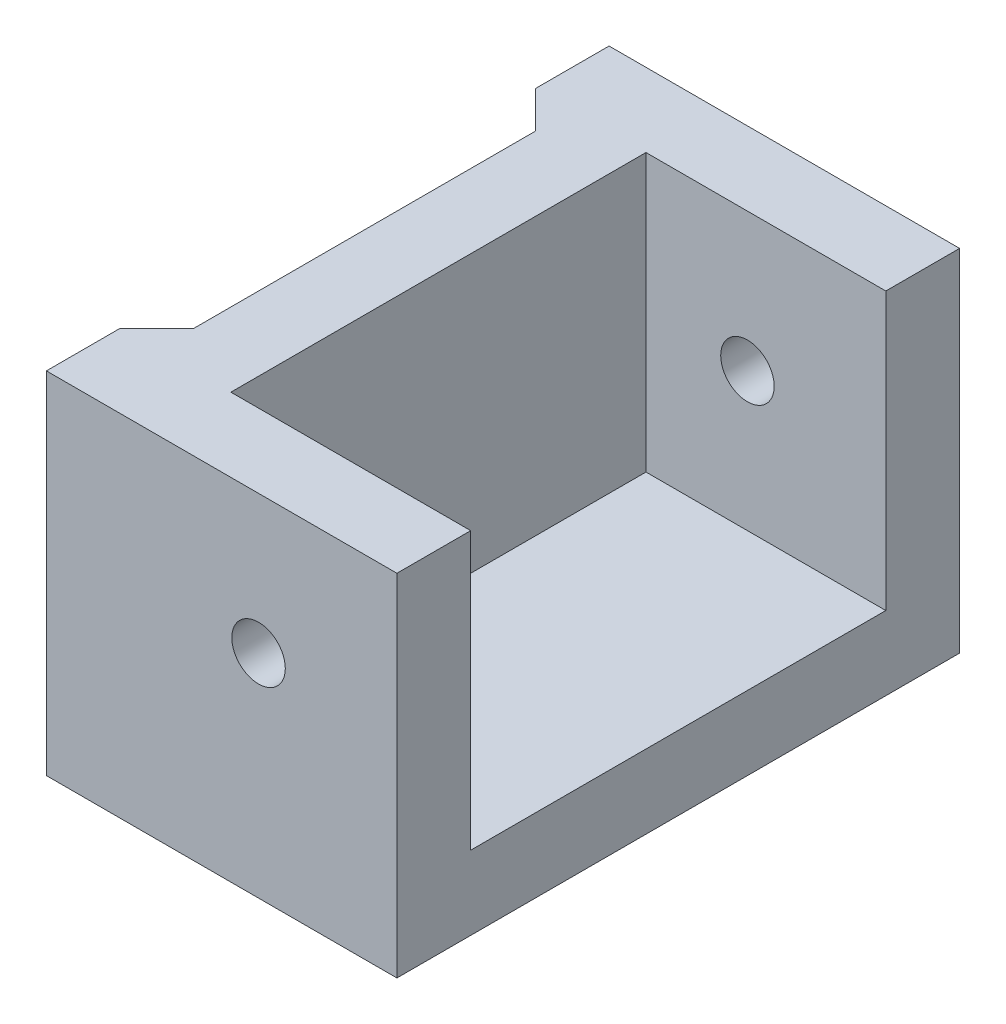
from build123d import *

# Parameters (mm, degrees)
BOSS_EXTRUDE1_DEPTH = 38.735
SKETCH2_W           = 24.13
SKETCH2_H           = 24.13
SKETCH2_R           = 1.8415
BOSS_EXTRUDE2_DEPTH = 5.08
BOSS_EXTRUDE3_START = -5.08
SKETCH3_W           = 24.13
SKETCH3_H           = 24.13
SKETCH3_R           = 1.8415
BOSS_EXTRUDE3_DEPTH = 5.08
SKETCH4_W           = 38.735
SKETCH4_H           = 5.875923506
BOSS_EXTRUDE5_DEPTH = 21.59
SKETCH5_W           = 28.575
SKETCH5_H           = 2.54
CUT_EXTRUDE1_DEPTH  = 16.51
CHAMFER2_SIZE       = 2.54


with BuildPart() as part:
    # Sketch1 → Boss-Extrude1 (new body)
    with BuildSketch(Plane.XY):
        Polygon((0, 0), (21.59, 0), (21.59, 5.08), (5.08, 5.08), (5.08, 21.59), (0, 21.59), (0, 5.08), align=None)
    extrude(amount=BOSS_EXTRUDE1_DEPTH)

    # Sketch2 → Boss-Extrude2 (add)
    with BuildSketch(Plane.XY.offset(38.735)):
        with Locations((9.525, 9.525)):
            Rectangle(SKETCH2_W, SKETCH2_H)
        with Locations((12.065, 12.065)):
            Circle(SKETCH2_R, mode=Mode.SUBTRACT)
    extrude(amount=-BOSS_EXTRUDE2_DEPTH)

    # Sketch3 → Boss-Extrude3 (add)
    with BuildSketch(Plane(origin=(0, 0, 0), x_dir=(-1, 0, 0), z_dir=(0, 0, -1)).offset(BOSS_EXTRUDE3_START)):
        with Locations((-9.525, 9.525)):
            Rectangle(SKETCH3_W, SKETCH3_H)
        with Locations(Location((-12.065, 12.065, 0), (0, 0, 180))):
            Circle(SKETCH3_R, mode=Mode.SUBTRACT)
    extrude(amount=BOSS_EXTRUDE3_DEPTH)

    # Sketch4 → Boss-Extrude5 (add)
    with BuildSketch(Plane(origin=(21.59, 0, 0), x_dir=(0, 0, -1), z_dir=(1, 0, 0))):
        with Locations((-19.3675, 0.397961753)):
            Rectangle(SKETCH4_W, SKETCH4_H)
    extrude(amount=-BOSS_EXTRUDE5_DEPTH)

    # Sketch5 → Cut-Extrude1 (cut)
    with BuildSketch(Plane(origin=(21.59, 0, 0), x_dir=(0, 0, -1), z_dir=(1, 0, 0))):
        with Locations((-19.3675, 3.81)):
            Rectangle(SKETCH5_W, SKETCH5_H)
    extrude(amount=-CUT_EXTRUDE1_DEPTH, mode=Mode.SUBTRACT)

    # Chamfer2
    chamfer2_edges = [part.edges().sort_by_distance(p)[0] for p in [
        (0, 9.525, 33.655),
        (0, 9.525, 5.08),
    ]]
    chamfer(chamfer2_edges, length=CHAMFER2_SIZE - 0.0001)  # a hair under: the kernel refuses the full size


solid = part.part
